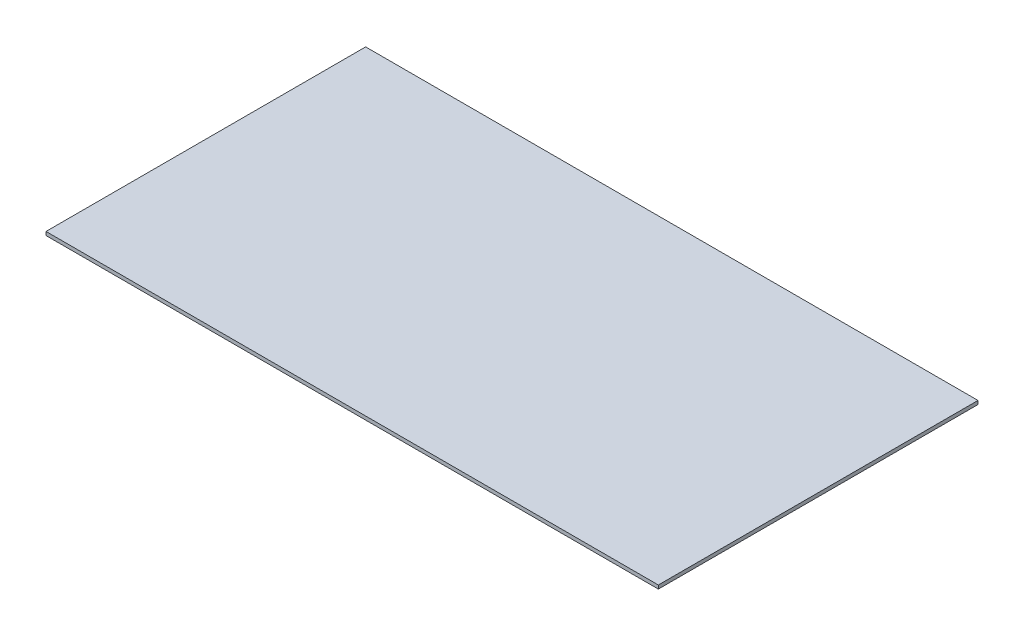
from build123d import *

# Parameters (mm, degrees)
SKETCH1_W           = 543.73
SKETCH1_H           = 3.175
BOSS_EXTRUDE1_DEPTH = 283.825
CUT_EXTRUDE1_DEPTH  = 1.3
SKETCH2_W           = 9
SKETCH2_H           = 9
SKETCH2_R           = 1.925
BOSS_EXTRUDE2_DEPTH = 3.125
SKETCH3_W           = 9
SKETCH3_H           = 9
CUT_EXTRUDE2_DEPTH  = 10


with BuildPart() as part:
    # Sketch1 → Boss-Extrude1 (new body)
    with BuildSketch(Plane.XY):
        with Locations((-308.730031966, 1.266681686)):
            Rectangle(SKETCH1_W, SKETCH1_H)
    extrude(amount=BOSS_EXTRUDE1_DEPTH)

    # GasketGroove → Cut-Extrude1 (cut)
    with BuildSketch(Plane.XZ.offset(0.320818314)):
        with BuildLine():
            Line((-37.865031966, 2), (-37.865031966, 281.825))
            ThreePointArc((-37.865031966, 281.825), (-38.157925185, 282.532106781), (-38.865031966, 282.825))
            Line((-38.865031966, 282.825), (-578.595031966, 282.825))
            ThreePointArc((-578.595031966, 282.825), (-579.302138747, 282.532106781), (-579.595031966, 281.825))
            Line((-579.595031966, 281.825), (-579.595031966, 2))
            ThreePointArc((-579.595031966, 2), (-579.302138747, 1.292893219), (-578.595031966, 1))
            Line((-578.595031966, 1), (-38.865031966, 1))
            ThreePointArc((-38.865031966, 1), (-38.157925185, 1.292893219), (-37.865031966, 2))
        make_face()
        with BuildLine():
            Line((-577.595031966, 279.825), (-577.595031966, 4))
            ThreePointArc((-577.595031966, 4), (-577.302138747, 3.292893219), (-576.595031966, 3))
            Line((-576.595031966, 3), (-40.865031966, 3))
            ThreePointArc((-40.865031966, 3), (-40.157925185, 3.292893219), (-39.865031966, 4))
            Line((-39.865031966, 4), (-39.865031966, 279.825))
            ThreePointArc((-39.865031966, 279.825), (-40.157925185, 280.532106781), (-40.865031966, 280.825))
            Line((-40.865031966, 280.825), (-576.595031966, 280.825))
            ThreePointArc((-576.595031966, 280.825), (-577.302138747, 280.532106781), (-577.595031966, 279.825))
        make_face(mode=Mode.SUBTRACT)
    extrude(amount=-CUT_EXTRUDE1_DEPTH, mode=Mode.SUBTRACT)

    # Sketch2 → Boss-Extrude2 (add)
    # profile 1 of 4: a face of its own
    with BuildSketch(Plane(origin=(0, 2.854181686, 0), x_dir=(1, 0, 0), z_dir=(0, 1, 0))):
        with Locations((-476.095031966, -288.325)):
            Rectangle(SKETCH2_W, SKETCH2_H)
        with Locations((-476.095031966, -288.325)):
            Circle(SKETCH2_R, mode=Mode.SUBTRACT)
    # profile 2 of 4: a face of its own
    with BuildSketch(Plane(origin=(0, 2.854181686, 0), x_dir=(1, 0, 0), z_dir=(0, 1, 0))):
        with Locations((-141.365031966, -288.325)):
            Rectangle(SKETCH2_W, SKETCH2_H)
        with Locations((-141.365031966, -288.325)):
            Circle(SKETCH2_R, mode=Mode.SUBTRACT)
    # profile 3 of 4: a face of its own
    with BuildSketch(Plane(origin=(0, 2.854181686, 0), x_dir=(1, 0, 0), z_dir=(0, 1, 0))):
        with Locations((-141.365031966, 4.5)):
            Rectangle(SKETCH2_W, SKETCH2_H)
        with Locations((-141.365031966, 4.5)):
            Circle(SKETCH2_R, mode=Mode.SUBTRACT)
    # profile 4 of 4: a face of its own
    with BuildSketch(Plane(origin=(0, 2.854181686, 0), x_dir=(1, 0, 0), z_dir=(0, 1, 0))):
        with Locations((-476.095031966, 4.5)):
            Rectangle(SKETCH2_W, SKETCH2_H)
        with Locations((-476.095031966, 4.5)):
            Circle(SKETCH2_R, mode=Mode.SUBTRACT)
    extrude(amount=-BOSS_EXTRUDE2_DEPTH)

    # Sketch3 → Cut-Extrude2 (cut)
    with BuildSketch(Plane(origin=(0, 2.854181686, 0), x_dir=(1, 0, 0), z_dir=(0, 1, 0))):
        with Locations((-476.095031966, 4.5)):
            Rectangle(SKETCH3_W, SKETCH3_H)
        with Locations((-141.365031966, 4.5)):
            Rectangle(SKETCH3_W, SKETCH3_H)
        with Locations((-141.365031966, -288.325)):
            Rectangle(SKETCH3_W, SKETCH3_H)
        with Locations((-476.095031966, -288.325)):
            Rectangle(SKETCH3_W, SKETCH3_H)
    extrude(amount=-CUT_EXTRUDE2_DEPTH, mode=Mode.SUBTRACT)


solid = part.part
